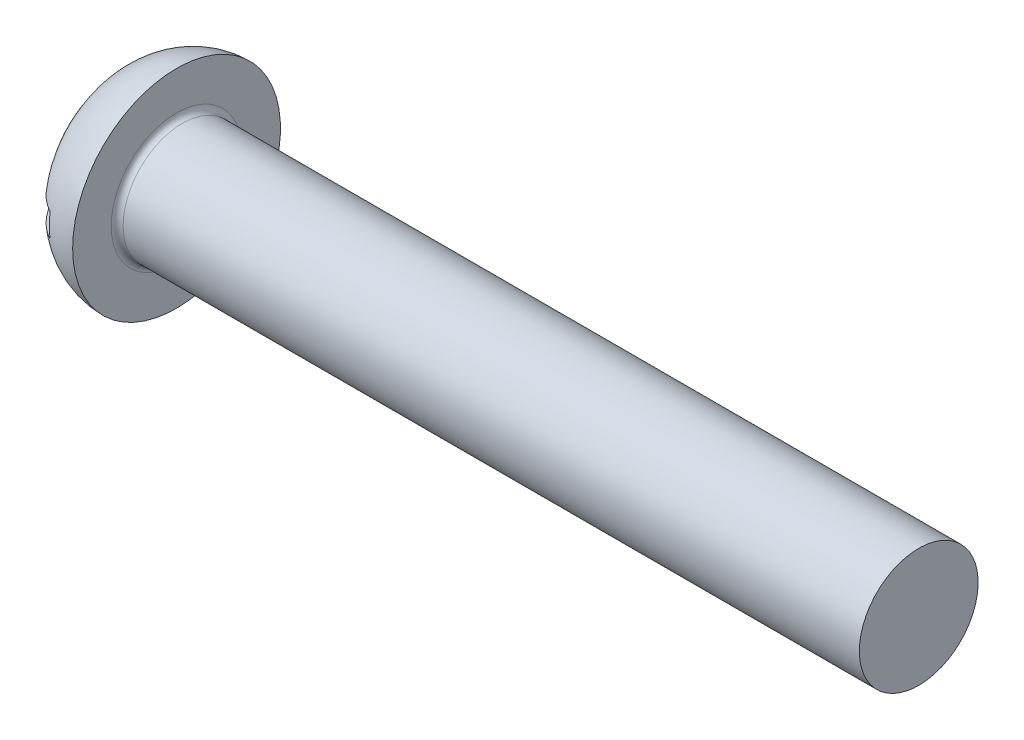
from build123d import *

# Parameters (mm, degrees)
FILLET1_R  = 0.4
SLOTSKE_W  = 14
SLOTSKE_H  = 1.6
SLOT_DEPTH = 3.3


with BuildPart() as part:
    # BodySke → BaseBody (revolve)
    with BuildSketch(Plane.XY):
        with BuildLine():
            Line((5.4, 4), (5.4, 7))
            ThreePointArc((5.4, 7), (3.455602942, 6.543518244), (1.887955218, 5.30596577))
            ThreePointArc((1.887955218, 5.30596577), (0.486051043, 2.815921148), (0, 0))
            Line((0, 0), (55.4, 0))
            Line((55.4, 0), (55.4, 4))
            Line((55.4, 4), (5.4, 4))
        make_face()
    revolve(axis=Axis((0, 0, 0), (1, 0, 0)))

    # Fillet1
    fillet1_edges = [part.edges().sort_by_distance(p)[0] for p in [
        (5.4, -4, 0),
    ]]
    fillet(fillet1_edges, radius=FILLET1_R)

    # SlotSke → Slot (cut)
    with BuildSketch(Plane(origin=(0, 0, 0), x_dir=(0, 0, -1), z_dir=(1, 0, 0))):
        Rectangle(SLOTSKE_W, SLOTSKE_H)
    extrude(amount=SLOT_DEPTH, mode=Mode.SUBTRACT)


solid = part.part
